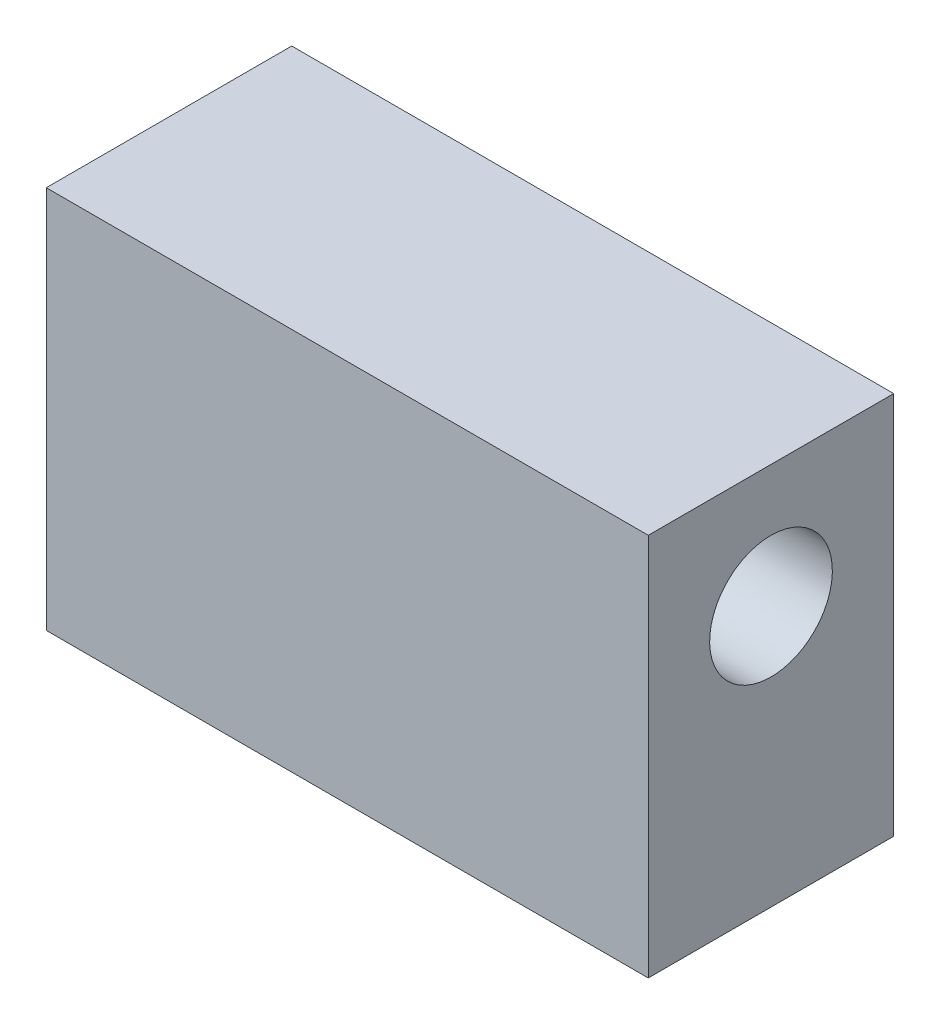
from build123d import *
from build123d.topology import SkipClean

# Parameters (mm, degrees)
SKETCH3_W                      = 31.148374891
SKETCH3_H                      = 19.837641971
BOSS_EXTRUDE1_DEPTH            = 6.35
SKETCH4_R                      = 3.175
CUT_EXTRUDE1_DEPTH             = 9.525
SKETCH5_R                      = 3.175
CUT_EXTRUDE5_DEPTH             = 9.525
CUT_EXTRUDE5_DIRECTION_2_REACH = 33.299
SKETCH6_R                      = 3.175
CUT_EXTRUDE6_DEPTH             = 9.525


with BuildPart() as part:
    # Sketch3 → Boss-Extrude1 (new, symmetric)
    with BuildSketch(Plane.XY):
        with Locations((15.574187446, -9.918820986)):
            Rectangle(SKETCH3_W, SKETCH3_H)
    extrude(amount=BOSS_EXTRUDE1_DEPTH, both=True)

    # Sketch4 → Cut-Extrude1 (cut)
    with BuildSketch(Plane.ZY):
        with Locations((0, -6.35)):
            Circle(SKETCH4_R)
    cut_extrude1 = extrude(amount=-CUT_EXTRUDE1_DEPTH, mode=Mode.SUBTRACT)

    # Sketch5 → Cut-Extrude5 (cut)
    with BuildSketch(Plane(origin=(7.787093723, -19.837641971, 0), x_dir=(-0.8660254037844382, 0.500000000000001, 0), z_dir=(-0.500000000000001, -0.8660254037844382, 0))):
        Circle(SKETCH5_R)
    cut_extrude5 = extrude(amount=-CUT_EXTRUDE5_DEPTH, mode=Mode.SUBTRACT)

    # Sketch5 → Cut-Extrude5 direction 2 (cut, up to next)
    with BuildSketch(Plane(origin=(7.787093723, -19.837641971, 0), x_dir=(-0.8660254037844382, 0.500000000000001, 0), z_dir=(-0.500000000000001, -0.8660254037844382, 0)), mode=Mode.PRIVATE) as cut_extrude5_direction_2_sk1:
        Circle(SKETCH5_R)
    cut_extrude5_direction_2_tool1 = extrude(cut_extrude5_direction_2_sk1.sketch, amount=CUT_EXTRUDE5_DIRECTION_2_REACH, mode=Mode.PRIVATE) & part.part
    cut_extrude5_direction_2 = cut_extrude5_direction_2_tool1.solids().sort_by_distance((7.787094, -19.837642, 0))[0]
    add(cut_extrude5_direction_2, mode=Mode.SUBTRACT)

    # Sketch6 → Cut-Extrude6 (cut)
    with BuildSketch(Plane(origin=(0, 0, -6.35), x_dir=(-1, 0, 0), z_dir=(0, 0, -1))):
        with Locations((-15.574187445, -6.35)):
            Circle(SKETCH6_R)
    extrude(amount=-CUT_EXTRUDE6_DEPTH, mode=Mode.SUBTRACT)

    # Mirror1: Cut-Extrude1, Cut-Extrude5, Cut-Extrude5 direction 2 across plane
    with SkipClean():  # the faces are left unmerged after this step: merging them gives an invalid solid
        add(cut_extrude1.mirror(Plane.ZY.offset(-15.574187445)), mode=Mode.SUBTRACT)
        add(cut_extrude5.mirror(Plane.ZY.offset(-15.574187445)), mode=Mode.SUBTRACT)
        add(cut_extrude5_direction_2.mirror(Plane.ZY.offset(-15.574187445)), mode=Mode.SUBTRACT)


solid = part.part
